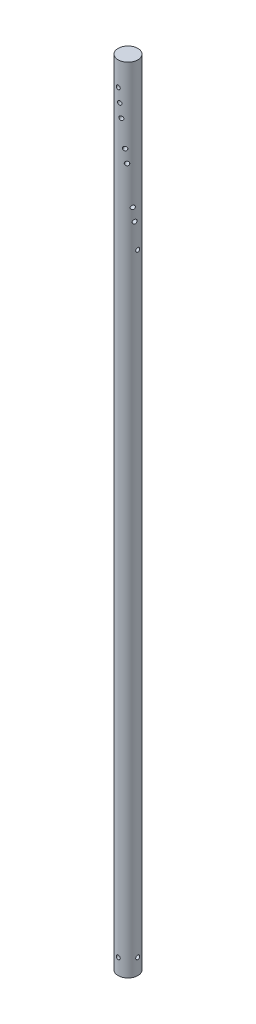
from build123d import *

# Parameters (mm, degrees)
SKETCH1_R                            = 12.5
BOSS_EXTRUDE1_DEPTH                  = 1000
F_8_0_199_DIAMETER_HOLE2_D           = 5.0546
F_8_0_199_DIAMETER_HOLE2_ON_FACE_2_D = 5.0546
F_8_0_199_DIAMETER_HOLE2_ON_FACE_3_D = 5.0546
F_8_0_199_DIAMETER_HOLE2_ON_FACE_4_D = 5.0546
F_8_0_199_DIAMETER_HOLE2_ON_FACE_5_D = 5.0546
F_8_0_199_DIAMETER_HOLE2_ON_FACE_6_D = 5.0546
F_8_0_199_DIAMETER_HOLE2_ON_FACE_7_D = 5.0546
F_8_0_199_DIAMETER_HOLE2_ON_FACE_8_D = 5.0546
F_8_0_199_DIAMETER_HOLE2_ON_FACE_9_D = 5.0546
F_8_0_199_DIAMETER_HOLE3_D           = 5.0546
F_8_0_199_DIAMETER_HOLE3_ON_FACE_2_D = 5.0546


with BuildPart() as part:
    # Sketch1 → Boss-Extrude1 (new body)
    with BuildSketch(Plane(origin=(0, 0, 0), x_dir=(1, 0, 0), z_dir=(0, 1, 0))):
        Circle(SKETCH1_R)
    extrude(amount=BOSS_EXTRUDE1_DEPTH)

    # #8 (0.199) Diameter Hole2 (through all)
    with Locations(Plane(origin=(-1.783348234, 953.823333682, -12.372132762), x_dir=(-0.989770620943, 0, 0.142667858744), z_dir=(-0.142667858744, 0, -0.989770620943))):
        with Locations((0, 0)):
            Hole(F_8_0_199_DIAMETER_HOLE2_D / 2)

    # #8 (0.199) Diameter Hole2 on face 2 (through all)
    with Locations(Plane(origin=(-3.519384538, 937.748682132, -11.99432918), x_dir=(-0.959546243861, 0, 0.281551071554), z_dir=(-0.281551071554, 0, -0.959546243861))):
        with Locations((0, 0)):
            Hole(F_8_0_199_DIAMETER_HOLE2_ON_FACE_2_D / 2)

    # #8 (0.199) Diameter Hole2 on face 3 (through all)
    with Locations(Plane(origin=(-6.759001407, 905.443893927, -10.515032097), x_dir=(-0.84120274528, 0, 0.540719836268), z_dir=(-0.540719836268, 0, -0.84120274528))):
        with Locations((0, 0)):
            Hole(F_8_0_199_DIAMETER_HOLE2_ON_FACE_3_D / 2)

    # #8 (0.199) Diameter Hole2 on face 4 (through all)
    with Locations(Plane(origin=(-8.185863626, 889.316932398, -9.446779171), x_dir=(-0.75574223514, 0, 0.654869203754), z_dir=(-0.654869203754, 0, -0.75574223514))):
        with Locations((0, 0)):
            Hole(F_8_0_199_DIAMETER_HOLE2_ON_FACE_4_D / 2)

    # #8 (0.199) Diameter Hole2 on face 5 (through all)
    with Locations(Plane(origin=(-11.370011696, 840.917539006, -5.193537719), x_dir=(0.415482978709, 0, -0.909600953388), z_dir=(-0.909600953388, 0, -0.415482978709))):
        with Locations((0, 0)):
            Hole(F_8_0_199_DIAMETER_HOLE2_ON_FACE_5_D / 2)

    # #8 (0.199) Diameter Hole2 on face 6 (through all)
    with Locations(Plane(origin=(-11.993662164, 824.772727469, -3.521656981), x_dir=(0.281732957692, 0, -0.959492855914), z_dir=(-0.959492855914, 0, -0.281732957692))):
        with Locations((0, 0)):
            Hole(F_8_0_199_DIAMETER_HOLE2_ON_FACE_6_D / 2)

    # #8 (0.199) Diameter Hole2 on face 7 (through all)
    with Locations(Plane(origin=(0, 970, -12.5), x_dir=(-1, 0, 0), z_dir=(0, 0, -1))):
        with Locations((0, 0)):
            Hole(F_8_0_199_DIAMETER_HOLE2_ON_FACE_7_D / 2)

    # #8 (0.199) Diameter Hole2 on face 8 (through all)
    with Locations(Plane(origin=(-11.370399947, 840.909090807, -5.192687652), x_dir=(0.415415000488, 0, -0.909632001069), z_dir=(-0.909632001069, 0, -0.415415000488))):
        with Locations((0, 0)):
            Hole(F_8_0_199_DIAMETER_HOLE2_ON_FACE_8_D / 2)

    # #8 (0.199) Diameter Hole2 on face 9 (through all)
    with Locations(Plane(origin=(-12.5, 792.500077077, -8.526e-06), x_dir=(1e-06, 0, -1.0), z_dir=(-1.0, 0, -1e-06))):
        with Locations((0, 0)):
            Hole(F_8_0_199_DIAMETER_HOLE2_ON_FACE_9_D / 2)

    # #8 (0.199) Diameter Hole3 (through all)
    with Locations(Plane(origin=(-12.5, 20, 0), x_dir=(0, 0, -1), z_dir=(-1, 0, 0))):
        with Locations((0, 0)):
            Hole(F_8_0_199_DIAMETER_HOLE3_D / 2)

    # #8 (0.199) Diameter Hole3 on face 2 (through all)
    with Locations(Plane(origin=(0, 20, -12.5), x_dir=(-1, 0, 0), z_dir=(0, 0, -1))):
        with Locations((0, 0)):
            Hole(F_8_0_199_DIAMETER_HOLE3_ON_FACE_2_D / 2)


solid = part.part
